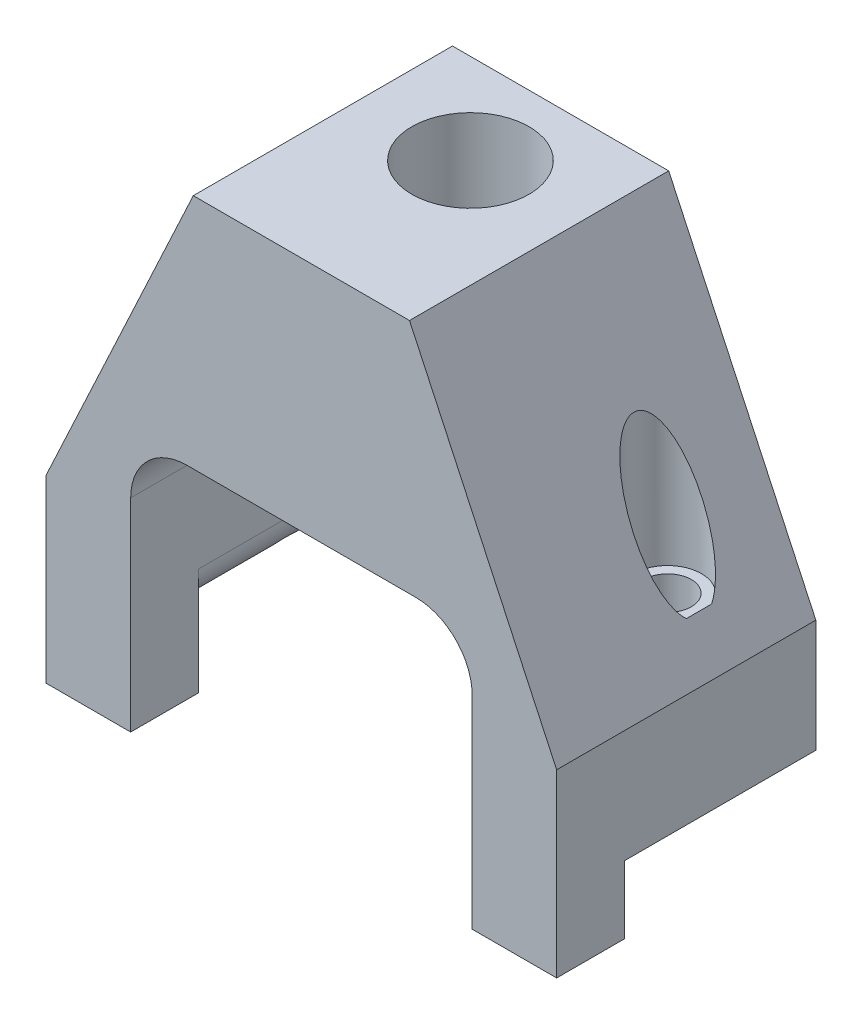
from build123d import *

# Parameters (mm, degrees)
BOSS_EXTRUDE1_DEPTH      = 11.5
CUT_EXTRUDE1_DEPTH       = 30.162647342
CUT_EXTRUDE1_DEPTH_BACK  = 30.162647342
SKETCH3_R                = 1.05
BOSS_EXTRUDE2_DEPTH      = 3
BOSS_EXTRUDE2_DEPTH_BACK = 11.5
SKETCH4_W                = 3.75
SKETCH4_H                = 3
CUT_EXTRUDE2_DEPTH       = 32.200320548
CUT_EXTRUDE2_DEPTH_BACK  = 32.200320548
SKETCH5_R                = 1.25
CHAMFER1_SIZE            = 6.528307214
CHAMFER1_SIZE_2          = 14
CHAMFER2_SIZE            = 6.528307214
CHAMFER2_SIZE_2          = 14
SKETCH6_R                = 2.6
CUT_EXTRUDE3_DEPTH       = 5
SKETCH7_R                = 1.5
CUT_EXTRUDE4_DEPTH       = 12


with BuildPart() as part:
    # Sketch1 → Boss-Extrude1 (new body)
    with BuildSketch(Plane.XY):
        with BuildLine():
            Line((16.91, 0), (18.9, 0))
            Line((18.9, 0), (18.9, 19))
            Line((18.9, 19), (-3.75, 19))
            Line((-3.75, 19), (-3.75, 0))
            Line((-3.75, 0), (-1.76, 0))
            ThreePointArc((-1.76, 0), (-0.515492065, 0.515492065), (0, 1.76))
            Line((0, 1.76), (0, 6))
            ThreePointArc((0, 6), (0.732233047, 7.767766953), (2.5, 8.5))
            Line((2.5, 8.5), (12.65, 8.5))
            ThreePointArc((12.65, 8.5), (14.417766953, 7.767766953), (15.15, 6))
            Line((15.15, 6), (15.15, 1.76))
            ThreePointArc((15.15, 1.76), (15.665492065, 0.515492065), (16.91, 0))
        make_face()
    extrude(amount=-BOSS_EXTRUDE1_DEPTH)

    # Sketch3 → Cut-Extrude1 (cut, two sides: drawn at the far end of the back side and taken through both)
    with BuildSketch(Plane(origin=(0, 19, 0), x_dir=(1, 0, 0), z_dir=(0, 1, 0)).offset(-CUT_EXTRUDE1_DEPTH_BACK)):
        with Locations(Location((-1.425, 7.25, 0), (0, 0, 251.394661296))):
            Circle(SKETCH3_R)
        with Locations(Location((16.575, 7.25, 0), (0, 0, 288.605338704))):
            Circle(SKETCH3_R)
    extrude(amount=CUT_EXTRUDE1_DEPTH + CUT_EXTRUDE1_DEPTH_BACK, mode=Mode.SUBTRACT)

    # Sketch4 → Boss-Extrude2 (add, two sides: drawn at the far end of the back side and taken through both)
    with BuildSketch(Plane.XZ.offset(-BOSS_EXTRUDE2_DEPTH_BACK)):
        with Locations((17.025, -1.5)):
            Rectangle(SKETCH4_W, SKETCH4_H)
        with Locations((-1.875, -1.5)):
            Rectangle(SKETCH4_W, SKETCH4_H)
    extrude(amount=BOSS_EXTRUDE2_DEPTH + BOSS_EXTRUDE2_DEPTH_BACK)

    # Sketch5 → Cut-Extrude2 (cut, two sides: drawn at the far end of the back side and taken through both)
    with BuildSketch(Plane(origin=(0, 19, 0), x_dir=(1, 0, 0), z_dir=(0, 1, 0)).offset(-CUT_EXTRUDE2_DEPTH_BACK)):
        with Locations(Location((7.575, 7.5, 0), (0, 0, 90))):
            Circle(SKETCH5_R)
    extrude(amount=CUT_EXTRUDE2_DEPTH + CUT_EXTRUDE2_DEPTH_BACK, mode=Mode.SUBTRACT)

    # Chamfer1
    # the kernel refuses this chamfer: 14, 6.528307214 mm, written as the material it takes off along each edge
    with BuildSketch(Plane(origin=(-3.75, 19, 36.2736566), x_dir=(0.9971975577536776, 0.07481330637059945, 0), z_dir=(0, 0, -1))) as chamfer1_piece_1:
        Polygon((CHAMFER1_SIZE * 0.99719755778, CHAMFER1_SIZE * 0.0748133063725), (-CHAMFER1_SIZE_2 * 0.0748133063706, CHAMFER1_SIZE_2 * 0.997197557754), (0, 0), align=None)
    extrude(amount=84.0473132, mode=Mode.SUBTRACT)

    # Chamfer2
    # the kernel refuses this chamfer: 14, 6.528307214 mm, written as the material it takes off along each edge
    with BuildSketch(Plane(origin=(18.9, 19, 36.2736566), x_dir=(-0.9971975577536776, 0.07481330637059945, 0), z_dir=(0, 0, -1))) as chamfer2_piece_1:
        Polygon((CHAMFER2_SIZE * 0.99719755778, -CHAMFER2_SIZE * 0.0748133063725), (-CHAMFER2_SIZE_2 * 0.0748133063706, -CHAMFER2_SIZE_2 * 0.997197557754), (0, 0), align=None)
    extrude(amount=84.0473132, mode=Mode.SUBTRACT)

    # Sketch6 → Cut-Extrude3 (cut)
    with BuildSketch(Plane(origin=(0, 19, 0), x_dir=(1, 0, 0), z_dir=(0, 1, 0))):
        with Locations(Location((7.575, 7.5, 0), (0, 0, 270))):
            Circle(SKETCH6_R)
    extrude(amount=-CUT_EXTRUDE3_DEPTH, mode=Mode.SUBTRACT)

    # Sketch7 → Cut-Extrude4 (cut)
    with BuildSketch(Plane(origin=(0, 19, 0), x_dir=(1, 0, 0), z_dir=(0, 1, 0))):
        with Locations((-1.425, 7.25)):
            Circle(SKETCH7_R)
        with Locations((16.575, 7.25)):
            Circle(SKETCH7_R)
    extrude(amount=-CUT_EXTRUDE4_DEPTH, mode=Mode.SUBTRACT)


solid = part.part
